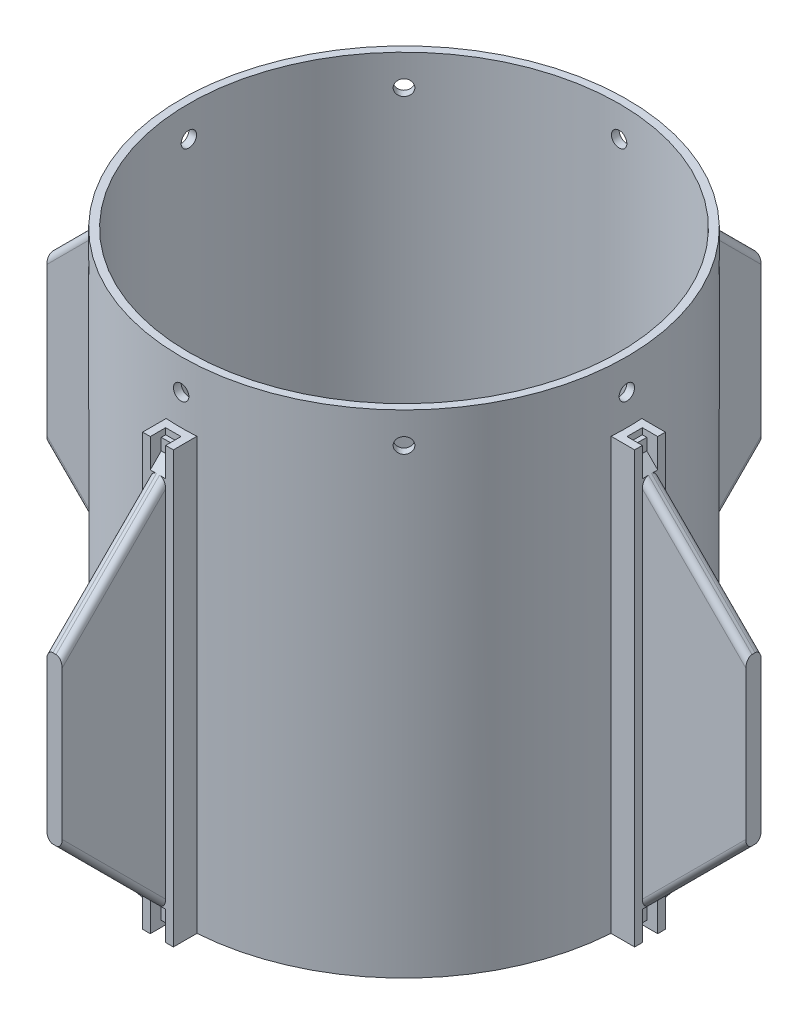
from build123d import *

# Parameters (mm, degrees)
SKETCH1_R          = 92.075
SKETCH1_R_2        = 88.9
BASE_SHELL_DEPTH   = 203.2
SKETCH2_R          = 88.9
SKETCH2_R_2        = 3.175
SKETCH2_R_3        = 3.174999998
SKETCH2_R_4        = 3.174999999
SKETCH2_R_5        = 3.175000001
BOLT_INSERT_DEPTH  = 6.35
FIN_BRACKET_DEPTH  = 177.8
CIRPATTERN1_COUNT  = 4
BASE_FIN_DEPTH     = 3.175
FIN_PATTERN_COUNT  = 4
FIN_FILLETS_R      = 2.54
SKETCH5_R          = 3.175
CUT_EXTRUDE1_DEPTH = 289.02456558
CIRPATTERN2_COUNT  = 8


with BuildPart() as part:
    # Sketch1 → Base Shell (new body)
    with BuildSketch(Plane(origin=(0, 0, 0), x_dir=(1, 0, 0), z_dir=(0, 1, 0))):
        Circle(SKETCH1_R)
        Circle(SKETCH1_R_2, mode=Mode.SUBTRACT)
    extrude(amount=BASE_SHELL_DEPTH)

    # Sketch2 → Bolt Insert (add)
    with BuildSketch(Plane.XZ):
        Circle(SKETCH2_R)
        with Locations((0, 79.375)):
            Circle(SKETCH2_R_2, mode=Mode.SUBTRACT)
        with Locations((79.375000001, -1e-09)):
            Circle(SKETCH2_R_3, mode=Mode.SUBTRACT)
        with Locations((0, -79.375000003)):
            Circle(SKETCH2_R_4, mode=Mode.SUBTRACT)
        with Locations((-79.375000001, -1e-09)):
            Circle(SKETCH2_R_5, mode=Mode.SUBTRACT)
        with BuildLine():
            ThreePointArc((-78.8035, -9.507839542), (-56.126600757, -56.126600757), (-9.507839542, -78.8035))
            ThreePointArc((-9.507839542, -78.8035), (0, -69.85), (9.507839542, -78.8035))
            ThreePointArc((9.507839542, -78.8035), (56.126600757, -56.126600757), (78.8035, -9.507839542))
            ThreePointArc((78.8035, -9.507839542), (69.85, 0), (78.8035, 9.507839542))
            ThreePointArc((78.8035, 9.507839542), (56.126600757, 56.126600757), (9.507839542, 78.8035))
            ThreePointArc((9.507839542, 78.8035), (0, 69.85), (-9.507839542, 78.8035))
            ThreePointArc((-9.507839542, 78.8035), (-56.126600757, 56.126600757), (-78.8035, 9.507839542))
            ThreePointArc((-78.8035, 9.507839542), (-69.85, 0), (-78.8035, -9.507839542))
        make_face(mode=Mode.SUBTRACT)
    extrude(amount=-BOLT_INSERT_DEPTH)

    # Sketch3 → Fin Bracket (add)
    with BuildSketch(Plane(origin=(0, 0, 0), x_dir=(1, 0, 0), z_dir=(0, 1, 0))):
        with BuildLine():
            Line((-3.175, 101.6), (-6.35, 101.6))
            Line((-6.35, 101.6), (-6.35, 91.855773498))
            ThreePointArc((-6.35, 91.855773498), (0, 92.075), (6.35, 91.855773498))
            Line((6.35, 91.855773498), (6.35, 101.6))
            Line((6.35, 101.6), (3.175, 101.6))
            Line((3.175, 101.6), (3.175, 95.25))
            Line((3.175, 95.25), (-3.175, 95.25))
            Line((-3.175, 95.25), (-3.175, 101.6))
        make_face()
    fin_bracket = extrude(amount=FIN_BRACKET_DEPTH)

    # CirPattern1: Fin Bracket ×4 about axis
    cirpattern1_axis = Axis((0, 203.2, 0), (0, -1, 0))
    for i in range(1, CIRPATTERN1_COUNT):
        add(fin_bracket.rotate(cirpattern1_axis, i * 360 / CIRPATTERN1_COUNT))

    # Sketch4 → Base Fin (add, symmetric)
    with BuildSketch(Plane.XY):
        Polygon((91.855773498, 175.26), (91.855773498, 2.54), (97.071111515, 2.54), (97.071111515, 7.402102448), (144.339721451, 54.670712385), (144.339721451, 123.129287615), (97.071111515, 170.397897552), (97.071111515, 175.26), align=None)
    base_fin = extrude(amount=BASE_FIN_DEPTH, both=True)

    # Fin Pattern: Base Fin ×4 about axis
    fin_pattern_axis = Axis((0, 203.2, 0), (0, -1, 0))
    for i in range(1, FIN_PATTERN_COUNT):
        add(base_fin.rotate(fin_pattern_axis, i * 360 / FIN_PATTERN_COUNT))

    # Fin Fillets
    fin_fillets_edges = [part.edges().sort_by_distance(p)[0] for p in [
        (122.969860726, 33.300851659, 3.175),
        (122.969860726, 33.300851659, -3.175),
        (122.969860726, 144.499148341, -3.175),
        (122.969860726, 144.499148341, 3.175),
        (3.175, 33.300851659, -122.969860726),
        (-3.175, 33.300851659, -122.969860726),
        (3.175, 144.499148341, -122.969860726),
        (-3.175, 144.499148341, -122.969860726),
        (-122.969860726, 144.499148341, 3.175),
        (-122.969860726, 144.499148341, -3.175),
        (-122.969860726, 33.300851659, -3.175),
        (-122.969860726, 33.300851659, 3.175),
        (3.175, 33.300851659, 122.969860726),
        (-3.175, 33.300851659, 122.969860726),
        (3.175, 144.499148341, 122.969860726),
        (-3.175, 144.499148341, 122.969860726),
    ]]
    fillet(fin_fillets_edges, radius=FIN_FILLETS_R)

    # Sketch5 → Cut-Extrude1 (cut, through all)
    with BuildSketch(Plane.XY):
        with Locations((0, 190.5)):
            Circle(SKETCH5_R)
    cut_extrude1 = extrude(amount=-CUT_EXTRUDE1_DEPTH, mode=Mode.SUBTRACT)

    # CirPattern2: Cut-Extrude1 ×8 about axis
    cirpattern2_axis = Axis((0, 203.2, 0), (0, 1, 0))
    for i in range(1, CIRPATTERN2_COUNT):
        add(cut_extrude1.rotate(cirpattern2_axis, i * 360 / CIRPATTERN2_COUNT), mode=Mode.SUBTRACT)


solid = part.part
